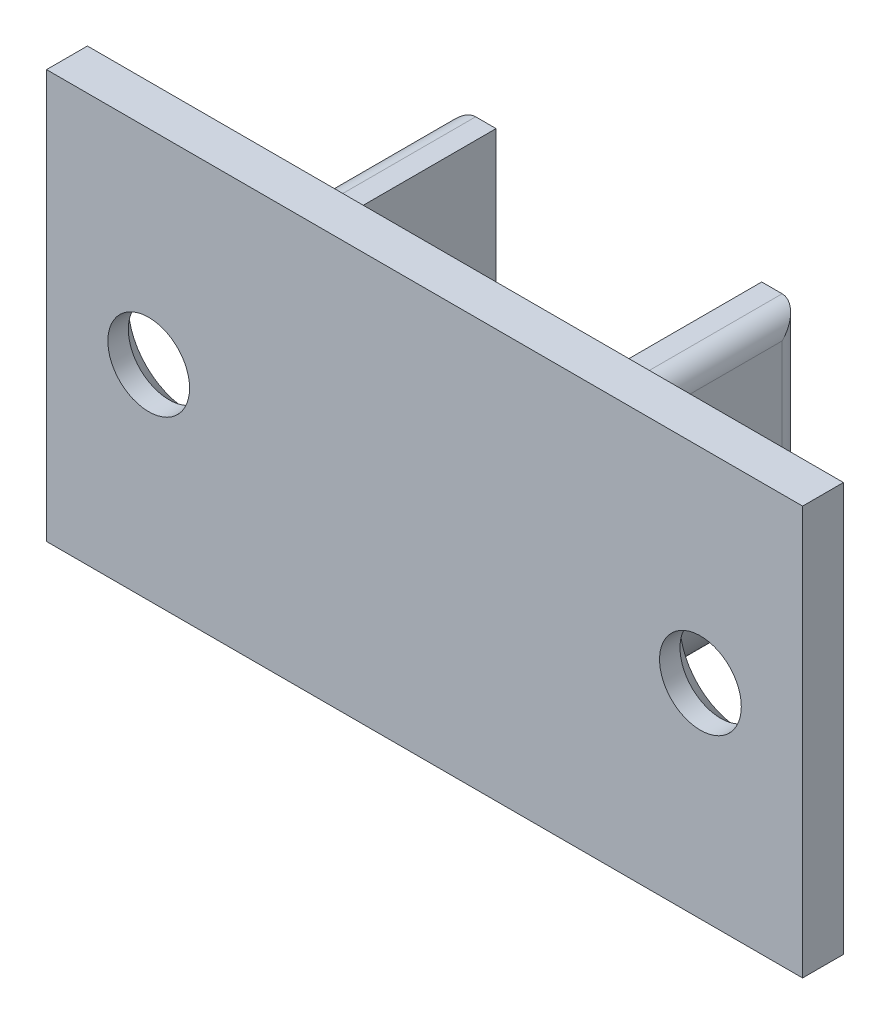
from build123d import *

# Parameters (mm, degrees)
ESQUISSE1_W        = 37
ESQUISSE1_H        = 20
ESQUISSE1_R        = 2
BOSS_EXTRU_3_DEPTH = 2
BOSS_EXTRU_4_DEPTH = 8
CONG_3_R           = 1
CHANFREIN2_SIZE    = 1


with BuildPart() as part:
    # Esquisse1 → Boss.-Extru.3 (new body)
    with BuildSketch(Plane.XY):
        with Locations((18.5, 10)):
            Rectangle(ESQUISSE1_W, ESQUISSE1_H)
        with Locations((5, 10)):
            Circle(ESQUISSE1_R, mode=Mode.SUBTRACT)
        with Locations((32, 10)):
            Circle(ESQUISSE1_R, mode=Mode.SUBTRACT)
    extrude(amount=BOSS_EXTRU_3_DEPTH)

    # Esquisse1<5> → Boss.-Extru.4 (add)
    with BuildSketch(Plane.XY):
        with BuildLine():
            ThreePointArc((25, 10), (18.5, 3.5), (12, 10))
            Line((12, 10), (12, 18.5))
            Line((12, 18.5), (10, 18.5))
            Line((10, 18.5), (10, 10))
            ThreePointArc((10, 10), (18.5, 1.5), (27, 10))
            Line((27, 10), (27, 18.5))
            Line((27, 18.5), (25, 18.5))
            Line((25, 18.5), (25, 10))
        make_face()
    extrude(amount=-BOSS_EXTRU_4_DEPTH)

    # Congé3
    cong_3_edges = [part.edges().sort_by_distance(p)[0] for p in [
        (27, 14.25, -8),
        (10, 14.25, -8),
        (27, 14.25, 0),
        (27, 18.5, -4),
        (10, 18.5, -4),
        (11, 18.5, 0),
        (26, 18.5, 0),
        (10, 14.25, 0),
        (18.5, 1.5, 0),
        (18.5, 1.5, -8),
    ]]
    fillet(cong_3_edges, radius=CONG_3_R)

    # Chanfrein2
    chanfrein2_edges = [part.edges().sort_by_distance(p)[0] for p in [
        (3, 10, 0),
        (30, 10, 0),
    ]]
    chamfer(chanfrein2_edges, length=CHANFREIN2_SIZE)


solid = part.part
